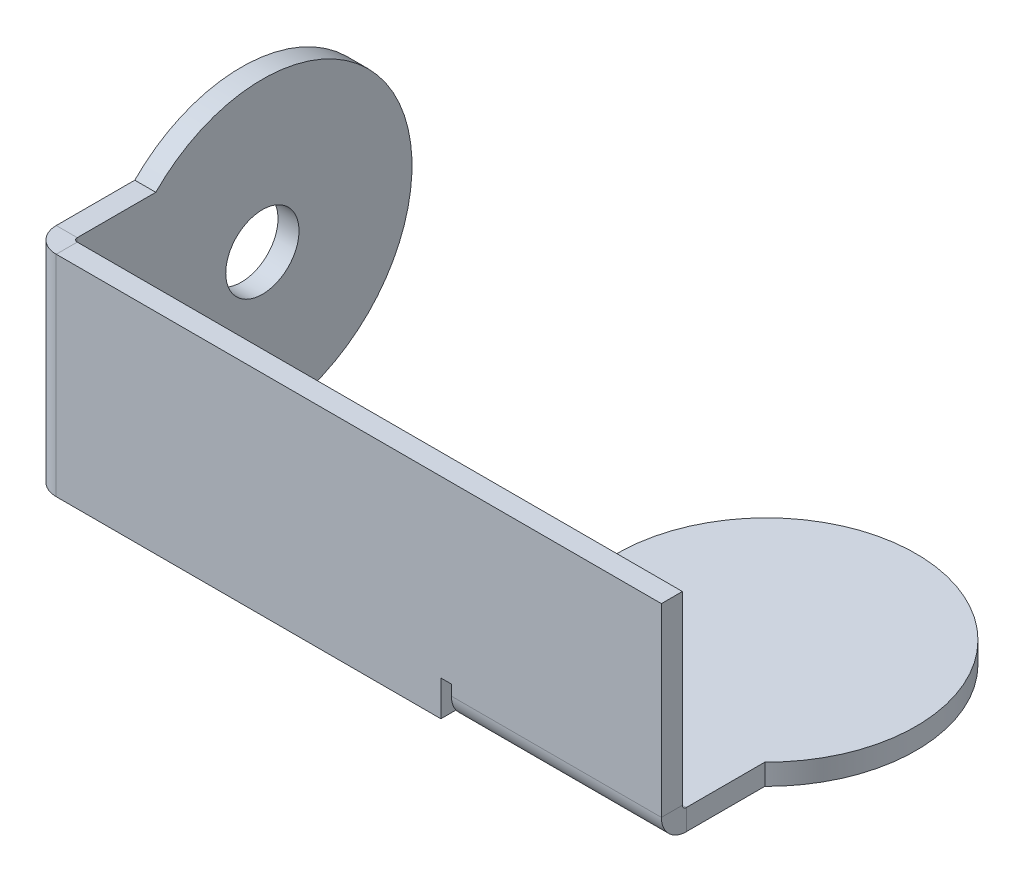
from build123d import *

# Parameters (mm, degrees)
SKETCH_1_W                        = 120
SKETCH_1_H                        = 40
SM_BASE_FLANGE_1_DEPTH            = 4
SM_EDGE_FLANGE_1_STRIP_W          = 17.4732
SM_EDGE_FLANGE_1_STRIP_H          = 4
SM_EDGE_FLANGE_1_STRIP_CUT_DEPTH  = 40
SM_EDGE_FLANGE_1_DEPTH            = 40
SKETCH_12_R                       = 28.5
EXTRUDE_1_DEPTH                   = 4
SKETCH_13_R                       = 6.979767345
CUT_EXTRUDE_2_DEPTH               = 4
SM_EDGE_FLANGE_2_STRIP_W          = 17.4732
SM_EDGE_FLANGE_2_STRIP_H          = 4
SM_EDGE_FLANGE_2_STRIP_CUT_DEPTH  = 40
SM_EDGE_FLANGE_2_RELIEF_W         = 19.4732
SM_EDGE_FLANGE_2_RELIEF_H         = 2
SM_EDGE_FLANGE_2_RELIEF_CUT_DEPTH = 4
SM_EDGE_FLANGE_2_DEPTH            = 40
SKETCH_17_R                       = 28.5
EXTRUDE_2_DEPTH                   = 4


# Sheet-metal steps are written as plain solids
with BuildPart() as part:
    # Sketch 1 → 基体-法兰1 (new body)
    with BuildSketch(Plane.XY):
        Rectangle(SKETCH_1_W, SKETCH_1_H)
    extrude(amount=-SM_BASE_FLANGE_1_DEPTH)

    # 边线-法兰1 strip (across the edge) → 边线-法兰1 strip cut (cut)
    with BuildSketch(Plane(origin=(-60, -20, -4), x_dir=(1, 0, 0), z_dir=(0, 1, 0))):
        with Locations((-4, -2)):
            Rectangle(SM_EDGE_FLANGE_1_STRIP_W, SM_EDGE_FLANGE_1_STRIP_H)
    extrude(amount=SM_EDGE_FLANGE_1_STRIP_CUT_DEPTH, mode=Mode.SUBTRACT)

    # 边线-法兰1 section (across the edge) → 边线-法兰1 (add)
    with BuildSketch(Plane(origin=(-60, -20, -4), x_dir=(1, 0, 0), z_dir=(0, 1, 0))):
        with BuildLine():
            Line((0, 0.7366), (0, 32))
            Line((0, 32), (4, 32))
            Line((4, 32), (4, 0.7366))
            ThreePointArc((4, 0.7366), (4.215745145, 0.215745145), (4.7366, 0))
            Line((4.7366, 0), (4.7366, -4))
            ThreePointArc((4.7366, -4), (1.38731802, -2.61268198), (0, 0.7366))
        make_face()
    extrude(amount=SM_EDGE_FLANGE_1_DEPTH)

    # 草图12 → 凸台-拉伸1 (add)
    with BuildSketch(Plane.ZY.offset(60)):
        with Locations((-40, 0)):
            Circle(SKETCH_12_R)
    extrude(amount=-EXTRUDE_1_DEPTH)

    # 草图13 → 切除-拉伸2 (cut)
    with BuildSketch(Plane.ZY.offset(60)):
        with Locations((-40, 0)):
            Circle(SKETCH_13_R)
    extrude(amount=-CUT_EXTRUDE_2_DEPTH, mode=Mode.SUBTRACT)

    # 边线-法兰2 strip (across the edge) → 边线-法兰2 strip cut (cut)
    with BuildSketch(Plane(origin=(60, -20, -4), x_dir=(0, 1, 0), z_dir=(-1, 0, 0))):
        with Locations((-4, -2)):
            Rectangle(SM_EDGE_FLANGE_2_STRIP_W, SM_EDGE_FLANGE_2_STRIP_H)
    extrude(amount=SM_EDGE_FLANGE_2_STRIP_CUT_DEPTH, mode=Mode.SUBTRACT)

    # 边线-法兰2 relief (on the sheet) → 边线-法兰2 relief cut (cut)
    with BuildSketch(Plane(origin=(60, -15.2634, -4), x_dir=(0, 1, 0), z_dir=(0, 0, -1))):
        with Locations((-7.7366, -41)):
            Rectangle(SM_EDGE_FLANGE_2_RELIEF_W, SM_EDGE_FLANGE_2_RELIEF_H)
    extrude(amount=-SM_EDGE_FLANGE_2_RELIEF_CUT_DEPTH, mode=Mode.SUBTRACT)

    # 边线-法兰2 section (across the edge) → 边线-法兰2 (add)
    with BuildSketch(Plane(origin=(60, -20, -4), x_dir=(0, 1, 0), z_dir=(-1, 0, 0))):
        with BuildLine():
            Line((0, 0.7366), (0, 30))
            Line((0, 30), (4, 30))
            Line((4, 30), (4, 0.7366))
            ThreePointArc((4, 0.7366), (4.215745145, 0.215745145), (4.7366, 0))
            Line((4.7366, 0), (4.7366, -4))
            ThreePointArc((4.7366, -4), (1.38731802, -2.61268198), (0, 0.7366))
        make_face()
    extrude(amount=SM_EDGE_FLANGE_2_DEPTH)

    # 草图17 → 凸台-拉伸2 (add)
    with BuildSketch(Plane.XZ.offset(20)):
        with Locations((40, -40)):
            Circle(SKETCH_17_R)
    extrude(amount=-EXTRUDE_2_DEPTH)


solid = part.part
